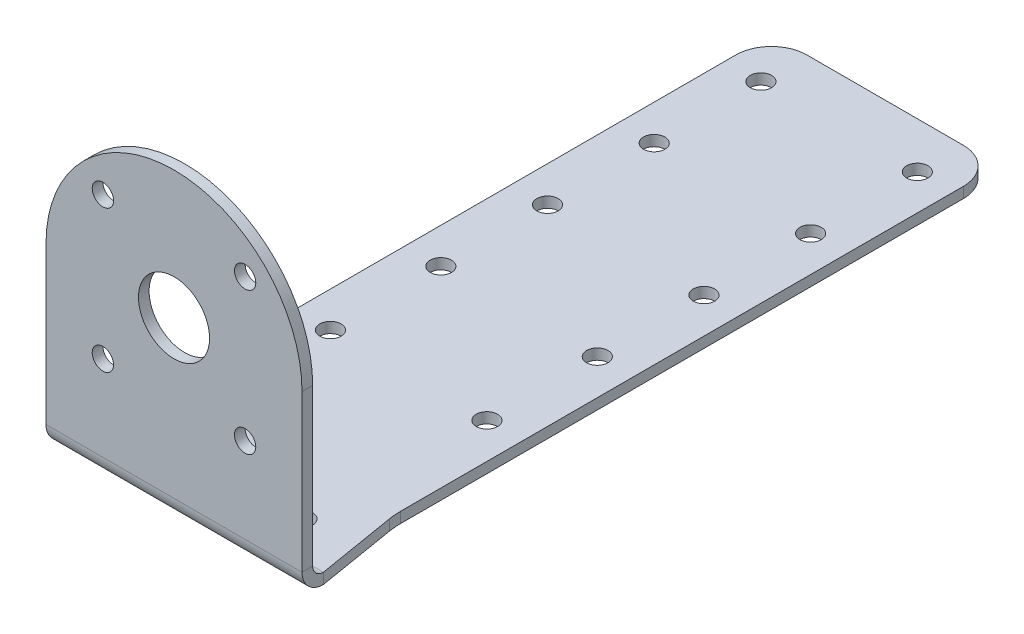
from build123d import *

# Parameters (mm, degrees)
SKETCH2_R                    = 1.5
BOSS_EXTRUDE1_DEPTH          = 1.5
EDGE_FLANGE1_STRIP_W         = 9
EDGE_FLANGE1_STRIP_H         = 1.5
EDGE_FLANGE1_STRIP_CUT_DEPTH = 36
EDGE_FLANGE1_DEPTH           = 36
CUT_EXTRUDE1_DEPTH           = 1.5
FILLET1_R                    = 10
SKETCH12_R                   = 1.5
CUT_EXTRUDE2_DEPTH           = 15


# Sheet-metal steps are written as plain solids
with BuildPart() as part:
    # Sketch2 → Boss-Extrude1 (new body)
    with BuildSketch(Plane.XY):
        with BuildLine():
            ThreePointArc((18, 12.5), (0, 30.5), (-18, 12.5))
            Line((-18, 12.5), (-18, -12.5))
            Line((-18, -12.5), (18, -12.5))
            Line((18, -12.5), (18, 12.5))
        make_face()
        with Locations((-10, 2.5)):
            Circle(SKETCH2_R, mode=Mode.SUBTRACT)
        with BuildLine():
            ThreePointArc((-3.535533906, 16.035533906), (0, 17.5), (3.535533906, 16.035533906))
            ThreePointArc((3.535533906, 16.035533906), (5, 12.5), (3.535533906, 8.964466094))
            ThreePointArc((3.535533906, 8.964466094), (0, 7.5), (-3.535533906, 8.964466094))
            ThreePointArc((-3.535533906, 8.964466094), (-5, 12.5), (-3.535533906, 16.035533906))
        make_face(mode=Mode.SUBTRACT)
        with Locations((10, 2.5)):
            Circle(SKETCH2_R, mode=Mode.SUBTRACT)
        with Locations((-10, 22.5)):
            Circle(SKETCH2_R, mode=Mode.SUBTRACT)
        with Locations((10, 22.5)):
            Circle(SKETCH2_R, mode=Mode.SUBTRACT)
    extrude(amount=BOSS_EXTRUDE1_DEPTH)

    # Edge-Flange1 strip (across the edge) → Edge-Flange1 strip cut (cut)
    with BuildSketch(Plane(origin=(18, -12.5, 0), x_dir=(0, 1, 0), z_dir=(-1, 0, 0))):
        with Locations((-1.5, -0.75)):
            Rectangle(EDGE_FLANGE1_STRIP_W, EDGE_FLANGE1_STRIP_H)
    extrude(amount=EDGE_FLANGE1_STRIP_CUT_DEPTH, mode=Mode.SUBTRACT)

    # Edge-Flange1 section (across the edge) → Edge-Flange1 (add)
    with BuildSketch(Plane(origin=(18, -12.5, 0), x_dir=(0, 1, 0), z_dir=(-1, 0, 0))):
        with BuildLine():
            Line((0, 1.5), (0, 98.5))
            Line((0, 98.5), (1.5, 98.5))
            Line((1.5, 98.5), (1.5, 1.5))
            ThreePointArc((1.5, 1.5), (1.939339828, 0.439339828), (3, 0))
            Line((3, 0), (3, -1.5))
            ThreePointArc((3, -1.5), (0.878679656, -0.621320344), (0, 1.5))
        make_face()
    extrude(amount=EDGE_FLANGE1_DEPTH)

    # Sketch11 → Cut-Extrude1 (cut)
    with BuildSketch(Plane(origin=(0, -11, 0), x_dir=(1, 0, 0), z_dir=(0, 1, 0))):
        with BuildLine():
            Line((-18, 98.5), (-18, 1.5))
            Line((-18, 1.5), (-16, 13.5))
            Line((-16, 13.5), (-16, 93.5))
            ThreePointArc((-16, 93.5), (-14.535533906, 97.035533906), (-11, 98.5))
            Line((-11, 98.5), (-18, 98.5))
        make_face()
        with BuildLine():
            Line((16, 13.5), (18, 1.5))
            Line((18, 1.5), (18, 98.5))
            Line((18, 98.5), (11, 98.5))
            ThreePointArc((11, 98.5), (14.535533906, 97.035533906), (16, 93.5))
            Line((16, 93.5), (16, 13.5))
        make_face()
    extrude(amount=-CUT_EXTRUDE1_DEPTH, mode=Mode.SUBTRACT)

    # Fillet1
    fillet1_edges = [part.edges().sort_by_distance(p)[0] for p in [
        (-16, -11.75, -13.5),
        (16, -11.75, -13.5),
    ]]
    fillet(fillet1_edges, radius=FILLET1_R)

    # Sketch12 → Cut-Extrude2 (cut)
    with BuildSketch(Plane(origin=(0, -11, 0), x_dir=(1, 0, 0), z_dir=(0, 1, 0))):
        with Locations(Location((-10, 6.5, 0), (0, 0, 270))):
            Circle(SKETCH12_R)
        with Locations(Location((-11, 31.5, 0), (0, 0, 270))):
            Circle(SKETCH12_R)
        with Locations(Location((-11, 47.024174696, 0), (0, 0, 270))):
            Circle(SKETCH12_R)
        with Locations(Location((-11, 62.024174696, 0), (0, 0, 270))):
            Circle(SKETCH12_R)
        with Locations(Location((-11, 77.024174696, 0), (0, 0, 270))):
            Circle(SKETCH12_R)
        with Locations(Location((-11, 92.024174696, 0), (0, 0, 270))):
            Circle(SKETCH12_R)
        with Locations(Location((11, 92.024174696, 0), (0, 0, 270))):
            Circle(SKETCH12_R)
        with Locations(Location((11, 77.024174696, 0), (0, 0, 270))):
            Circle(SKETCH12_R)
        with Locations(Location((11, 62.024174696, 0), (0, 0, 270))):
            Circle(SKETCH12_R)
        with Locations(Location((11, 47.024174696, 0), (0, 0, 270))):
            Circle(SKETCH12_R)
        with Locations(Location((11, 31.5, 0), (0, 0, 270))):
            Circle(SKETCH12_R)
        with Locations(Location((10, 6.5, 0), (0, 0, 270))):
            Circle(SKETCH12_R)
    extrude(amount=-CUT_EXTRUDE2_DEPTH, mode=Mode.SUBTRACT)


solid = part.part
